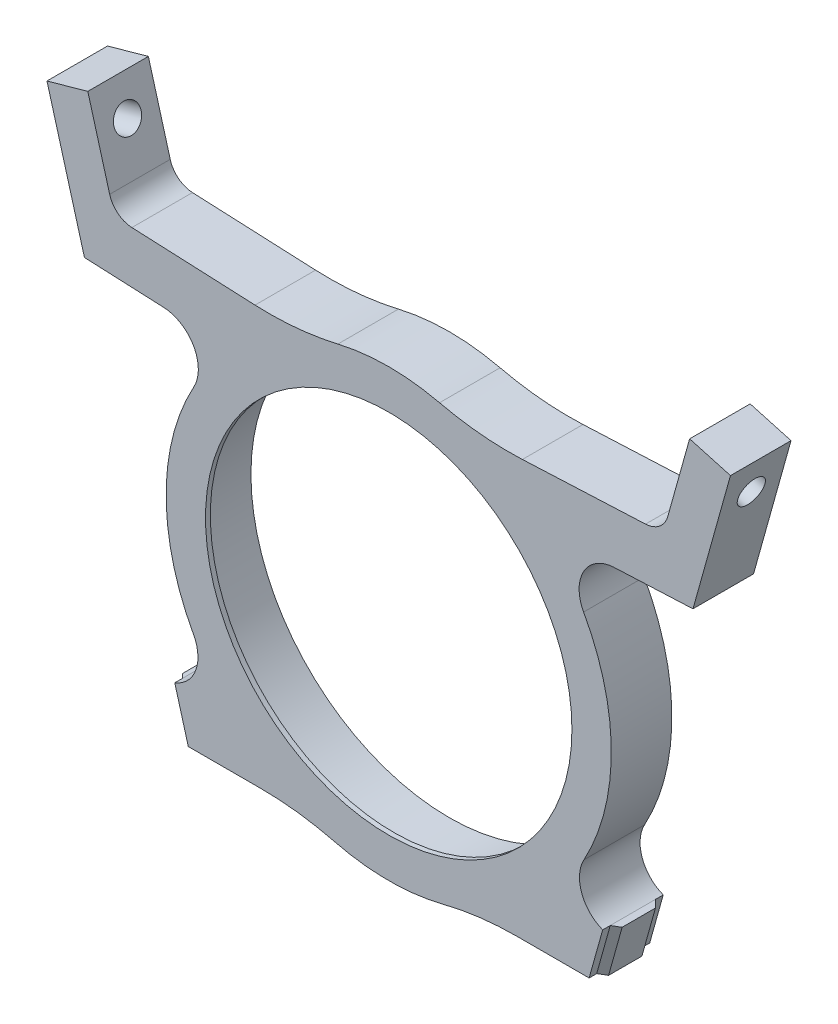
from build123d import *

# Parameters (mm, degrees)
SKIZZE1_R                       = 32.75
AUFSATZ_LINEAR_AUSTRAGEN1_DEPTH = 10
AUFSATZ_LINEAR_START            = -0.8
SKIZZE2_R                       = 32.75
SKIZZE2_R_2                     = 30.25
AUFSATZ_LINEAR_AUSTRAGEN2_DEPTH = 0.8
SKIZZE5_R                       = 2.25
SCHNITT_LINEAR_AUSTRAGEN1_DEPTH = 10
VERRUNDUNG1_R                   = 50
VERRUNDUNG2_R                   = 6
VERRUNDUNG3_R                   = 4
AUFSATZ_LINEAR_AUSTRAGEN3_DEPTH = 8.306468


with BuildPart() as part:
    # Skizze1 → Aufsatz-Linear austragen1 (new body)
    with BuildSketch(Plane.XY):
        with BuildLine():
            Line((-13.635878322, -34.12660725), (-33.089645956, -34.12660725))
            Line((-33.089645956, -34.12660725), (-35.325135331, -26.12660725))
            Line((-35.325135331, -26.12660725), (-25.844978112, -26.12660725))
            ThreePointArc((-25.844978112, -26.12660725), (-36.75, 0), (-25.844978112, 26.12660725))
            Line((-25.844978112, 26.12660725), (-50.235580292, 27.232429468))
            Line((-50.235580292, 27.232429468), (-52.656417654, 35.895722216))
            Line((-52.656417654, 35.895722216), (-56.424186432, 49.379190555))
            Line((-56.424186432, 49.379190555), (-49.682452262, 51.263074944))
            Line((-49.682452262, 51.263074944), (-45.294995525, 35.561969729))
            Line((-45.294995525, 35.561969729), (-13.635878322, 34.12660725))
            ThreePointArc((-13.635878322, 34.12660725), (0, 36.75), (13.635878322, 34.12660725))
            Line((13.635878322, 34.12660725), (45.294995525, 35.561969729))
            Line((45.294995525, 35.561969729), (49.682452262, 51.263074944))
            Line((49.682452262, 51.263074944), (56.424186432, 49.379190555))
            Line((56.424186432, 49.379190555), (52.656417654, 35.895722216))
            Line((52.656417654, 35.895722216), (50.235580292, 27.232429468))
            Line((50.235580292, 27.232429468), (25.844978112, 26.12660725))
            ThreePointArc((25.844978112, 26.12660725), (36.75, 0), (25.844978112, -26.12660725))
            Line((25.844978112, -26.12660725), (35.325135331, -26.12660725))
            Line((35.325135331, -26.12660725), (33.089645956, -34.12660725))
            Line((33.089645956, -34.12660725), (13.635878322, -34.12660725))
            ThreePointArc((13.635878322, -34.12660725), (0, -36.75), (-13.635878322, -34.12660725))
        make_face()
        Circle(SKIZZE1_R, mode=Mode.SUBTRACT)
    extrude(amount=AUFSATZ_LINEAR_AUSTRAGEN1_DEPTH)

    # Skizze2 → Aufsatz-Linear austragen2 (add)
    with BuildSketch(Plane.XY.offset(10).offset(AUFSATZ_LINEAR_START)):
        Circle(SKIZZE2_R)
        Circle(SKIZZE2_R_2, mode=Mode.SUBTRACT)
    extrude(amount=AUFSATZ_LINEAR_AUSTRAGEN2_DEPTH)

    # Skizze5 → Schnitt-Linear austragen1 (cut)
    with BuildSketch(Plane(origin=(32.796772797, -9.164604643, 0), x_dir=(0, 0, 1), z_dir=(-0.9631048813334842, 0.2691263412444341, 0))):
        with Locations(Location((5, 56.94978804, 0), (0, 0, 270))):
            Circle(SKIZZE5_R)
    schnitt_linear_austragen1 = extrude(amount=-SCHNITT_LINEAR_AUSTRAGEN1_DEPTH, mode=Mode.SUBTRACT)

    # Spiegeln1: Schnitt-Linear austragen1 across plane
    add(schnitt_linear_austragen1.mirror(Plane(origin=(0, 0, 0), x_dir=(0, 0, 1), z_dir=(1, 0, 0))), mode=Mode.SUBTRACT)

    # Verrundung1
    verrundung1_edges = [part.edges().sort_by_distance(p)[0] for p in [
        (13.635878322, 34.12660725, 5),
        (13.635878322, -34.12660725, 5),
        (-13.635878322, -34.12660725, 5),
        (-13.635878322, 34.12660725, 5),
    ]]
    fillet(verrundung1_edges, radius=VERRUNDUNG1_R)

    # Verrundung2
    # the kernel refuses this fillet: 6 mm, written as the material it adds along each edge
    with BuildSketch(Plane(origin=(-25.844978112, -26.12660725, 0), x_dir=(-1, 0, 0), z_dir=(0, 0, 1))) as verrundung2_piece_1:
        with BuildLine():
            CenterArc((11.651069987, -5.593490659), VERRUNDUNG2_R, 111.211936516, 97.493506366)
            Line((6.388466745, -8.475331584), (6.283214681, -8.532968403))
            ThreePointArc((6.283214681, -8.532968403), (3.405977683, -4.078058883), (-0.084391765, -0.085311371))
            Line((-0.084391765, -0.085311371), (0, 0.12))
            ThreePointArc((0, 0.12), (4.74007861, 0.12), (9.436738964, 0.111869813))
            Line((9.436738964, 0.111869813), (9.48015722, 0))
        make_face()
    extrude(amount=10)
    with BuildSketch(Plane(origin=(25.844978112, -26.12660725, 0), x_dir=(1, 0, 0), z_dir=(0, 0, 1))) as verrundung2_piece_2:
        with BuildLine():
            CenterArc((11.651069987, 5.593490659), VERRUNDUNG2_R, 151.294557118, 97.493506366)
            Line((6.388466745, 8.475331584), (6.283214681, 8.532968403))
            ThreePointArc((6.283214681, 8.532968403), (3.405977683, 4.078058883), (-0.084391765, 0.085311371))
            Line((-0.084391765, 0.085311371), (0, -0.12))
            ThreePointArc((0, -0.12), (4.74007861, -0.12), (9.436738964, -0.111869813))
            Line((9.436738964, -0.111869813), (9.48015722, 0))
        make_face()
    extrude(amount=10)
    with BuildSketch(Plane(origin=(25.844978112, 26.12660725, 0), x_dir=(0.603126946859045, -0.7976452130944475, 0), z_dir=(0, 0, 1))) as verrundung2_piece_3:
        with BuildLine():
            CenterArc((11.361383868, 5.938413704), VERRUNDUNG2_R, 145.501722428, 116.281978681)
            Line((6.416524574, 9.336702474), (6.317627388, 9.40466825))
            Line((6.317627388, 9.40466825), (-0.098897186, 0.067965775))
            Line((-0.098897186, 0.067965775), (0.017149259, -0.118768274))
            ThreePointArc((0.017149259, -0.118768274), (5.251960467, 0.257216064), (10.486771676, -0.118768274))
            Line((10.486771676, -0.118768274), (10.503920934, 0))
        make_face()
    extrude(amount=10)
    with BuildSketch(Plane(origin=(-25.844978112, 26.12660725, 0), x_dir=(-0.6031269468590452, -0.7976452130944475, 0), z_dir=(0, 0, 1))) as verrundung2_piece_4:
        with BuildLine():
            CenterArc((11.361383868, -5.938413704), VERRUNDUNG2_R, 98.216298891, 116.281978681)
            Line((6.416524574, -9.336702474), (6.317627388, -9.40466825))
            Line((6.317627388, -9.40466825), (-0.098897186, -0.067965775))
            Line((-0.098897186, -0.067965775), (0.017149259, 0.118768274))
            ThreePointArc((0.017149259, 0.118768274), (5.251960467, -0.257216064), (10.486771676, 0.118768274))
            Line((10.486771676, 0.118768274), (10.503920934, 0))
        make_face()
    extrude(amount=10)

    # Verrundung3
    verrundung3_edges = [part.edges().sort_by_distance(p)[0] for p in [
        (45.294995525, 35.561969729, 5),
        (-45.294995525, 35.561969729, 5),
    ]]
    fillet(verrundung3_edges, radius=VERRUNDUNG3_R)

    # Skizze6 → Aufsatz-Linear austragen3 (add)
    with BuildSketch(Plane(origin=(6.448861011, -23.078118218, 0), x_dir=(0, 0, -1), z_dir=(-0.26912634124443396, 0.9631048813334842, 0))):
        Polygon((-8.75, 41.05316849), (-7.75, 42.05316849), (-2.25, 42.05316849), (-1.25, 41.05316849), align=None)
    aufsatz_linear_austragen3 = extrude(amount=AUFSATZ_LINEAR_AUSTRAGEN3_DEPTH)

    # Spiegeln2: Aufsatz-Linear austragen3 across plane
    add(aufsatz_linear_austragen3.mirror(Plane(origin=(0, 0, 0), x_dir=(0, 0, 1), z_dir=(1, 0, 0))))


solid = part.part
